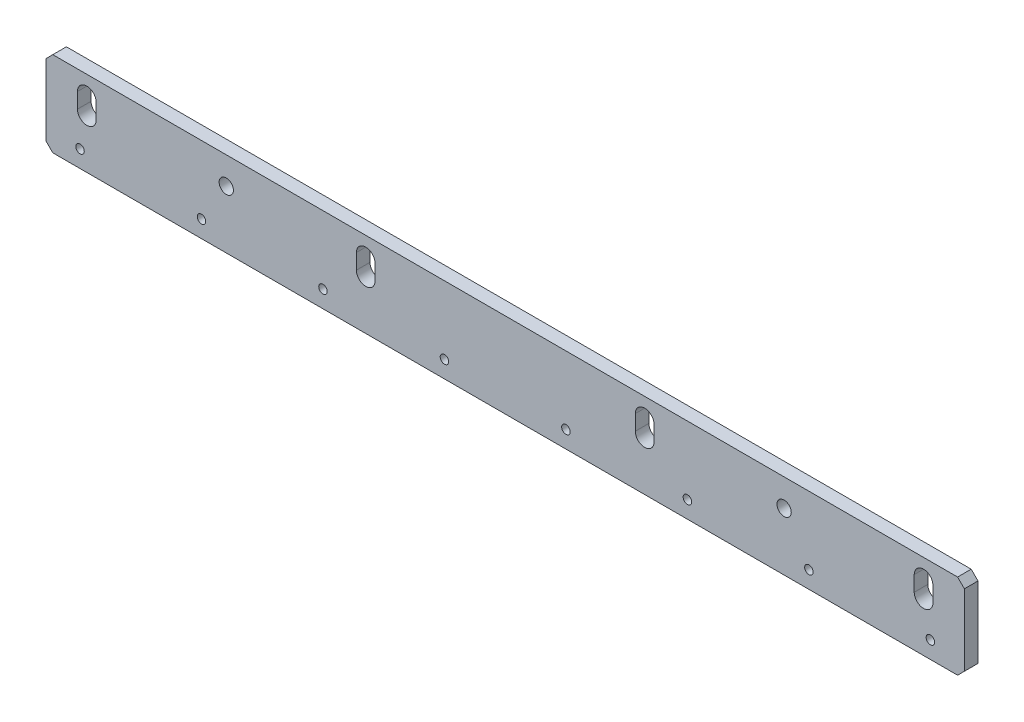
from build123d import *

# Parameters (mm, degrees)
SKETCH1_W                = 270
SKETCH1_H                = 25
BOSS_EXTRUDE1_DEPTH      = 4
M5_CLEARANCE_SLOT1_DEPTH = 4
LPATTERN1_COUNT          = 4
LPATTERN1_PITCH          = 82
M3_TAPPED_HOLE1_D        = 2.5
LPATTERN2_COUNT          = 8
LPATTERN2_PITCH          = 35.714285714
CHAMFER1_SIZE            = 2
M5_TAPPED_HOLE1_D        = 4.2


# Read off the part's stored shape, not the designer's step: M5 Clearance Slot1
with BuildPart() as part:
    # Sketch1 → Boss-Extrude1 (new body)
    with BuildSketch(Plane.XY):
        Rectangle(SKETCH1_W, SKETCH1_H)
    extrude(amount=BOSS_EXTRUDE1_DEPTH)

    # M5 Clearance Slot1 outline → M5 Clearance Slot1 (cut)
    with BuildSketch(Plane.XY):
        with BuildLine():
            Line((-120.25, 2.25), (-120.25, 6.75))
            ThreePointArc((-120.25, 6.75), (-123, 9.5), (-125.75, 6.75))
            Line((-125.75, 6.75), (-125.75, 2.25))
            ThreePointArc((-125.75, 2.25), (-123, -0.5), (-120.25, 2.25))
        make_face()
    m5_clearance_slot1 = extrude(amount=M5_CLEARANCE_SLOT1_DEPTH, mode=Mode.SUBTRACT)

    # LPattern1: M5 Clearance Slot1 ×4
    with Locations(*[(i * LPATTERN1_PITCH, 0, 0) for i in range(1, LPATTERN1_COUNT)]):
        add(m5_clearance_slot1, mode=Mode.SUBTRACT)

    # M3 Tapped Hole1 (through all)
    with Locations(Plane.XY.offset(4)):
        with Locations((-125, -7.5)):
            m3_tapped_hole1 = Hole(M3_TAPPED_HOLE1_D / 2)

    # LPattern2: M3 Tapped Hole1 ×8
    with Locations(*[(i * LPATTERN2_PITCH, 0, 0) for i in range(1, LPATTERN2_COUNT)]):
        add(m3_tapped_hole1, mode=Mode.SUBTRACT)

    # Chamfer1
    chamfer1_edges = [part.edges().sort_by_distance(p)[0] for p in [
        (-135, 12.5, 2),
        (135, 12.5, 2),
        (135, -12.5, 2),
        (-135, -12.5, 2),
    ]]
    chamfer(chamfer1_edges, length=CHAMFER1_SIZE)

    # M5 Tapped Hole1 (through all)
    with Locations(Plane.XY.offset(4)):
        with Locations((82, 4.5), (-82, 4.5)):
            Hole(M5_TAPPED_HOLE1_D / 2)


solid = part.part
